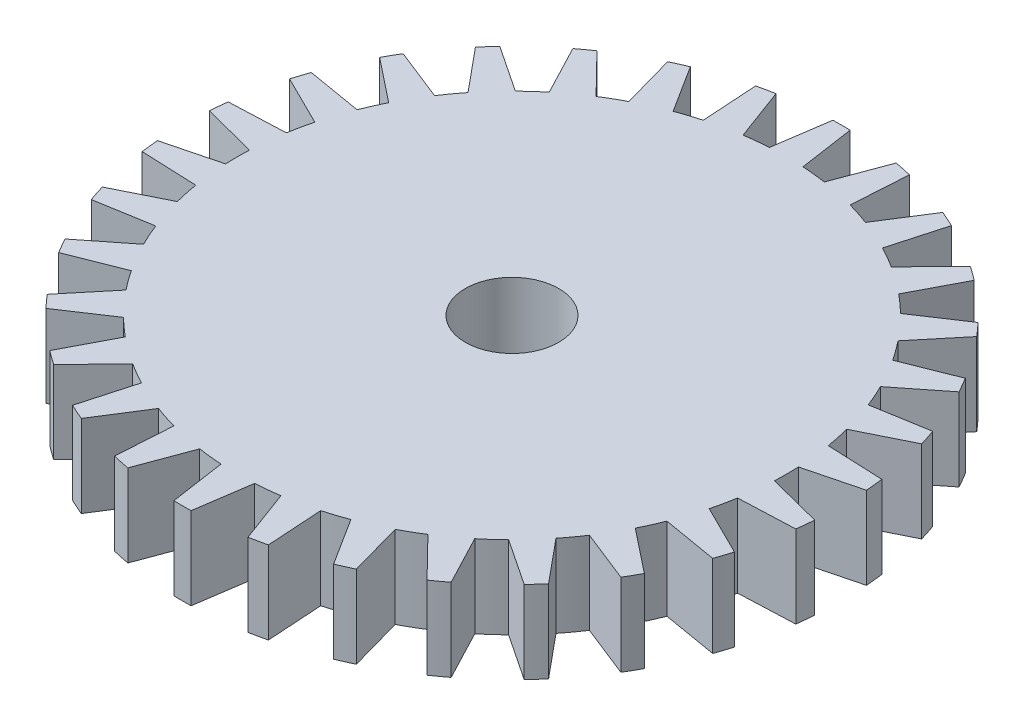
from build123d import *

# Parameters (mm, degrees)
BOSS_EXTRUDE1_DEPTH = 3
SKETCH2_R           = 1.7
CUT_EXTRUDE1_DEPTH  = 18.207950503


with BuildPart() as part:
    # Sketch1 → Boss-Extrude1 (new body)
    with BuildSketch(Plane(origin=(0, 0, 0), x_dir=(1, 0, 0), z_dir=(0, 1, 0))):
        with BuildLine():
            Line((-0.31412338, 11.9958879), (-0.610485395, 9.981347984))
            ThreePointArc((-0.610485395, 9.981347984), (-0.828082075, 9.965655025), (-1.045284633, 9.945218954))
            ThreePointArc((-1.045284633, 9.945218954), (-1.261989691, 9.920049497), (-1.478094111, 9.890158634))
            Line((-1.478094111, 9.890158634), (-2.186826306, 11.799058891))
            ThreePointArc((-2.186826306, 11.799058891), (-2.49494029, 11.737771209), (-2.801344366, 11.668439045))
            Line((-2.801344366, 11.668439045), (-2.672383761, 9.636304532))
            ThreePointArc((-2.672383761, 9.636304532), (-2.881962681, 9.575713608), (-3.090169944, 9.510565163))
            ThreePointArc((-3.090169944, 9.510565163), (-3.296906453, 9.440890204), (-3.502073813, 9.366721892))
            Line((-3.502073813, 9.366721892), (-4.592201188, 11.08655439))
            ThreePointArc((-4.592201188, 11.08655439), (-4.880839717, 10.962545492), (-5.166133162, 10.831023412))
            Line((-5.166133162, 10.831023412), (-4.617486132, 8.870108332))
            ThreePointArc((-4.617486132, 8.870108332), (-4.809887689, 8.767267557), (-5, 8.660254038))
            ThreePointArc((-5, 8.660254038), (-5.187732582, 8.549118707), (-5.372996083, 8.433914458))
            Line((-5.372996083, 8.433914458), (-6.796874843, 9.889514263))
            ThreePointArc((-6.796874843, 9.889514263), (-7.053423028, 9.708203932), (-7.305137148, 9.520240083))
            Line((-7.305137148, 9.520240083), (-6.360782203, 7.716245834))
            ThreePointArc((-6.360782203, 7.716245834), (-6.527597525, 7.575649844), (-6.691306064, 7.431448255))
            ThreePointArc((-6.691306064, 7.431448255), (-6.851829903, 7.283709699), (-7.009092643, 7.132504492))
            Line((-7.009092643, 7.132504492), (-8.704492452, 8.260254908))
            ThreePointArc((-8.704492452, 8.260254908), (-8.917737906, 8.029567276), (-9.124871587, 7.79337658))
            Line((-9.124871587, 7.79337658), (-7.826081569, 6.225146366))
            ThreePointArc((-7.826081569, 6.225146366), (-7.960020025, 6.05293988), (-8.090169944, 5.877852523))
            ThreePointArc((-8.090169944, 5.877852523), (-8.216469379, 5.699967626), (-8.338858221, 5.519369853))
            Line((-8.338858221, 5.519369853), (-10.231681972, 6.269982777))
            ThreePointArc((-10.231681972, 6.269982777), (-10.392304845, 6), (-10.545805352, 5.725905123))
            Line((-10.545805352, 5.725905123), (-8.949343616, 4.461978131))
            ThreePointArc((-8.949343616, 4.461978131), (-9.044551455, 4.265687399), (-9.135454576, 4.067366431))
            ThreePointArc((-9.135454576, 4.067366431), (-9.222009717, 3.867109616), (-9.30417568, 3.665012267))
            Line((-9.30417568, 3.665012267), (-11.311697893, 4.005682311))
            ThreePointArc((-11.311697893, 4.005682311), (-11.412678196, 3.708203932), (-11.505836818, 3.408184136))
            Line((-11.505836818, 3.408184136), (-9.681476404, 2.503800041))
            ThreePointArc((-9.681476404, 2.503800041), (-9.733792585, 2.292003909), (-9.781476007, 2.079116908))
            ThreePointArc((-9.781476007, 2.079116908), (-9.824503977, 1.86524036), (-9.862856015, 1.650476059))
            Line((-9.862856015, 1.650476059), (-11.897338336, 1.566314307))
            ThreePointArc((-11.897338336, 1.566314307), (-11.934262744, 1.254341559), (-11.963008005, 0.941509149))
            Line((-11.963008005, 0.941509149), (-9.990482216, 0.436193874))
            ThreePointArc((-9.990482216, 0.436193874), (-9.997620271, 0.21814885), (-10, 0))
            ThreePointArc((-10, 0), (-9.997620271, -0.21814885), (-9.990482216, -0.436193874))
            Line((-9.990482216, -0.436193874), (-11.963008005, -0.941509149))
            ThreePointArc((-11.963008005, -0.941509149), (-11.934262744, -1.254341559), (-11.897338336, -1.566314307))
            Line((-11.897338336, -1.566314307), (-9.862856015, -1.650476059))
            ThreePointArc((-9.862856015, -1.650476059), (-9.824503977, -1.86524036), (-9.781476007, -2.079116908))
            ThreePointArc((-9.781476007, -2.079116908), (-9.733792585, -2.292003909), (-9.681476404, -2.503800041))
            Line((-9.681476404, -2.503800041), (-11.505836818, -3.408184136))
            ThreePointArc((-11.505836818, -3.408184136), (-11.412678196, -3.708203932), (-11.311697893, -4.005682311))
            Line((-11.311697893, -4.005682311), (-9.30417568, -3.665012267))
            ThreePointArc((-9.30417568, -3.665012267), (-9.222009717, -3.867109616), (-9.135454576, -4.067366431))
            ThreePointArc((-9.135454576, -4.067366431), (-9.044551455, -4.265687399), (-8.949343616, -4.461978131))
            Line((-8.949343616, -4.461978131), (-10.545805352, -5.725905123))
            ThreePointArc((-10.545805352, -5.725905123), (-10.392304845, -6), (-10.231681972, -6.269982777))
            Line((-10.231681972, -6.269982777), (-8.338858221, -5.519369853))
            ThreePointArc((-8.338858221, -5.519369853), (-8.216469379, -5.699967626), (-8.090169944, -5.877852523))
            ThreePointArc((-8.090169944, -5.877852523), (-7.960020025, -6.05293988), (-7.826081569, -6.225146366))
            Line((-7.826081569, -6.225146366), (-9.124871587, -7.79337658))
            ThreePointArc((-9.124871587, -7.79337658), (-8.917737906, -8.029567276), (-8.704492452, -8.260254908))
            Line((-8.704492452, -8.260254908), (-7.009092643, -7.132504492))
            ThreePointArc((-7.009092643, -7.132504492), (-6.851829903, -7.283709699), (-6.691306064, -7.431448255))
            ThreePointArc((-6.691306064, -7.431448255), (-6.527597525, -7.575649844), (-6.360782203, -7.716245834))
            Line((-6.360782203, -7.716245834), (-7.305137148, -9.520240083))
            ThreePointArc((-7.305137148, -9.520240083), (-7.053423028, -9.708203932), (-6.796874843, -9.889514263))
            Line((-6.796874843, -9.889514263), (-5.372996083, -8.433914458))
            ThreePointArc((-5.372996083, -8.433914458), (-5.187732582, -8.549118707), (-5, -8.660254038))
            ThreePointArc((-5, -8.660254038), (-4.809887689, -8.767267557), (-4.617486132, -8.870108332))
            Line((-4.617486132, -8.870108332), (-5.166133162, -10.831023412))
            ThreePointArc((-5.166133162, -10.831023412), (-4.880839717, -10.962545492), (-4.592201188, -11.08655439))
            Line((-4.592201188, -11.08655439), (-3.502073813, -9.366721892))
            ThreePointArc((-3.502073813, -9.366721892), (-3.296906453, -9.440890204), (-3.090169944, -9.510565163))
            ThreePointArc((-3.090169944, -9.510565163), (-2.881962681, -9.575713608), (-2.672383761, -9.636304532))
            Line((-2.672383761, -9.636304532), (-2.801344366, -11.668439045))
            ThreePointArc((-2.801344366, -11.668439045), (-2.49494029, -11.737771209), (-2.186826306, -11.799058891))
            Line((-2.186826306, -11.799058891), (-1.478094111, -9.890158634))
            ThreePointArc((-1.478094111, -9.890158634), (-1.261989691, -9.920049497), (-1.045284633, -9.945218954))
            ThreePointArc((-1.045284633, -9.945218954), (-0.828082075, -9.965655025), (-0.610485395, -9.981347984))
            Line((-0.610485395, -9.981347984), (-0.31412338, -11.9958879))
            ThreePointArc((-0.31412338, -11.9958879), (0, -12), (0.31412338, -11.9958879))
            Line((0.31412338, -11.9958879), (0.610485395, -9.981347984))
            ThreePointArc((0.610485395, -9.981347984), (0.828082075, -9.965655025), (1.045284633, -9.945218954))
            ThreePointArc((1.045284633, -9.945218954), (1.261989691, -9.920049497), (1.478094111, -9.890158634))
            Line((1.478094111, -9.890158634), (2.186826306, -11.799058891))
            ThreePointArc((2.186826306, -11.799058891), (2.49494029, -11.737771209), (2.801344366, -11.668439045))
            Line((2.801344366, -11.668439045), (2.672383761, -9.636304532))
            ThreePointArc((2.672383761, -9.636304532), (2.881962681, -9.575713608), (3.090169944, -9.510565163))
            ThreePointArc((3.090169944, -9.510565163), (3.296906453, -9.440890204), (3.502073813, -9.366721892))
            Line((3.502073813, -9.366721892), (4.592201188, -11.08655439))
            ThreePointArc((4.592201188, -11.08655439), (4.880839717, -10.962545492), (5.166133162, -10.831023412))
            Line((5.166133162, -10.831023412), (4.617486132, -8.870108332))
            ThreePointArc((4.617486132, -8.870108332), (4.809887689, -8.767267557), (5, -8.660254038))
            ThreePointArc((5, -8.660254038), (5.187732582, -8.549118707), (5.372996083, -8.433914458))
            Line((5.372996083, -8.433914458), (6.796874843, -9.889514263))
            ThreePointArc((6.796874843, -9.889514263), (7.053423028, -9.708203932), (7.305137148, -9.520240083))
            Line((7.305137148, -9.520240083), (6.360782203, -7.716245834))
            ThreePointArc((6.360782203, -7.716245834), (6.527597525, -7.575649844), (6.691306064, -7.431448255))
            ThreePointArc((6.691306064, -7.431448255), (6.851829903, -7.283709699), (7.009092643, -7.132504492))
            Line((7.009092643, -7.132504492), (8.704492452, -8.260254908))
            ThreePointArc((8.704492452, -8.260254908), (8.917737906, -8.029567276), (9.124871587, -7.79337658))
            Line((9.124871587, -7.79337658), (7.826081569, -6.225146366))
            ThreePointArc((7.826081569, -6.225146366), (7.960020025, -6.05293988), (8.090169944, -5.877852523))
            ThreePointArc((8.090169944, -5.877852523), (8.216469379, -5.699967626), (8.338858221, -5.519369853))
            Line((8.338858221, -5.519369853), (10.231681972, -6.269982777))
            ThreePointArc((10.231681972, -6.269982777), (10.392304845, -6), (10.545805352, -5.725905123))
            Line((10.545805352, -5.725905123), (8.949343616, -4.461978131))
            ThreePointArc((8.949343616, -4.461978131), (9.044551455, -4.265687399), (9.135454576, -4.067366431))
            ThreePointArc((9.135454576, -4.067366431), (9.222009717, -3.867109616), (9.30417568, -3.665012267))
            Line((9.30417568, -3.665012267), (11.311697893, -4.005682311))
            ThreePointArc((11.311697893, -4.005682311), (11.412678196, -3.708203932), (11.505836818, -3.408184136))
            Line((11.505836818, -3.408184136), (9.681476404, -2.503800041))
            ThreePointArc((9.681476404, -2.503800041), (9.733792585, -2.292003909), (9.781476007, -2.079116908))
            ThreePointArc((9.781476007, -2.079116908), (9.824503977, -1.86524036), (9.862856015, -1.650476059))
            Line((9.862856015, -1.650476059), (11.897338336, -1.566314307))
            ThreePointArc((11.897338336, -1.566314307), (11.934262744, -1.254341559), (11.963008005, -0.941509149))
            Line((11.963008005, -0.941509149), (9.990482216, -0.436193874))
            ThreePointArc((9.990482216, -0.436193874), (9.997620271, -0.21814885), (10, 0))
            ThreePointArc((10, 0), (9.997620271, 0.21814885), (9.990482216, 0.436193874))
            Line((9.990482216, 0.436193874), (11.963008005, 0.941509149))
            ThreePointArc((11.963008005, 0.941509149), (11.934262744, 1.254341559), (11.897338336, 1.566314307))
            Line((11.897338336, 1.566314307), (9.862856015, 1.650476059))
            ThreePointArc((9.862856015, 1.650476059), (9.824503977, 1.86524036), (9.781476007, 2.079116908))
            ThreePointArc((9.781476007, 2.079116908), (9.733792585, 2.292003909), (9.681476404, 2.503800041))
            Line((9.681476404, 2.503800041), (11.505836818, 3.408184136))
            ThreePointArc((11.505836818, 3.408184136), (11.412678196, 3.708203932), (11.311697893, 4.005682311))
            Line((11.311697893, 4.005682311), (9.30417568, 3.665012267))
            ThreePointArc((9.30417568, 3.665012267), (9.222009717, 3.867109616), (9.135454576, 4.067366431))
            ThreePointArc((9.135454576, 4.067366431), (9.044551455, 4.265687399), (8.949343616, 4.461978131))
            Line((8.949343616, 4.461978131), (10.545805352, 5.725905123))
            ThreePointArc((10.545805352, 5.725905123), (10.392304845, 6), (10.231681972, 6.269982777))
            Line((10.231681972, 6.269982777), (8.338858221, 5.519369853))
            ThreePointArc((8.338858221, 5.519369853), (8.216469379, 5.699967626), (8.090169944, 5.877852523))
            ThreePointArc((8.090169944, 5.877852523), (7.960020025, 6.05293988), (7.826081569, 6.225146366))
            Line((7.826081569, 6.225146366), (9.124871587, 7.79337658))
            ThreePointArc((9.124871587, 7.79337658), (8.917737906, 8.029567276), (8.704492452, 8.260254908))
            Line((8.704492452, 8.260254908), (7.009092643, 7.132504492))
            ThreePointArc((7.009092643, 7.132504492), (6.851829903, 7.283709699), (6.691306064, 7.431448255))
            ThreePointArc((6.691306064, 7.431448255), (6.527597525, 7.575649844), (6.360782203, 7.716245834))
            Line((6.360782203, 7.716245834), (7.305137148, 9.520240083))
            ThreePointArc((7.305137148, 9.520240083), (7.053423028, 9.708203932), (6.796874843, 9.889514263))
            Line((6.796874843, 9.889514263), (5.372996083, 8.433914458))
            ThreePointArc((5.372996083, 8.433914458), (5.187732582, 8.549118707), (5, 8.660254038))
            ThreePointArc((5, 8.660254038), (4.809887689, 8.767267557), (4.617486132, 8.870108332))
            Line((4.617486132, 8.870108332), (5.166133162, 10.831023412))
            ThreePointArc((5.166133162, 10.831023412), (4.880839717, 10.962545492), (4.592201188, 11.08655439))
            Line((4.592201188, 11.08655439), (3.502073813, 9.366721892))
            ThreePointArc((3.502073813, 9.366721892), (3.296906453, 9.440890204), (3.090169944, 9.510565163))
            ThreePointArc((3.090169944, 9.510565163), (2.881962681, 9.575713608), (2.672383761, 9.636304532))
            Line((2.672383761, 9.636304532), (2.801344366, 11.668439045))
            ThreePointArc((2.801344366, 11.668439045), (2.49494029, 11.737771209), (2.186826306, 11.799058891))
            Line((2.186826306, 11.799058891), (1.478094111, 9.890158634))
            ThreePointArc((1.478094111, 9.890158634), (1.261989691, 9.920049497), (1.045284633, 9.945218954))
            ThreePointArc((1.045284633, 9.945218954), (0.828082075, 9.965655025), (0.610485395, 9.981347984))
            Line((0.610485395, 9.981347984), (0.31412338, 11.9958879))
            ThreePointArc((0.31412338, 11.9958879), (0, 12), (-0.31412338, 11.9958879))
        make_face()
    extrude(amount=BOSS_EXTRUDE1_DEPTH)

    # Sketch2 → Cut-Extrude1 (cut, through all)
    with BuildSketch(Plane(origin=(0, 3, 0), x_dir=(1, 0, 0), z_dir=(0, 1, 0))):
        Circle(SKETCH2_R)
    extrude(amount=-CUT_EXTRUDE1_DEPTH, mode=Mode.SUBTRACT)


solid = part.part
